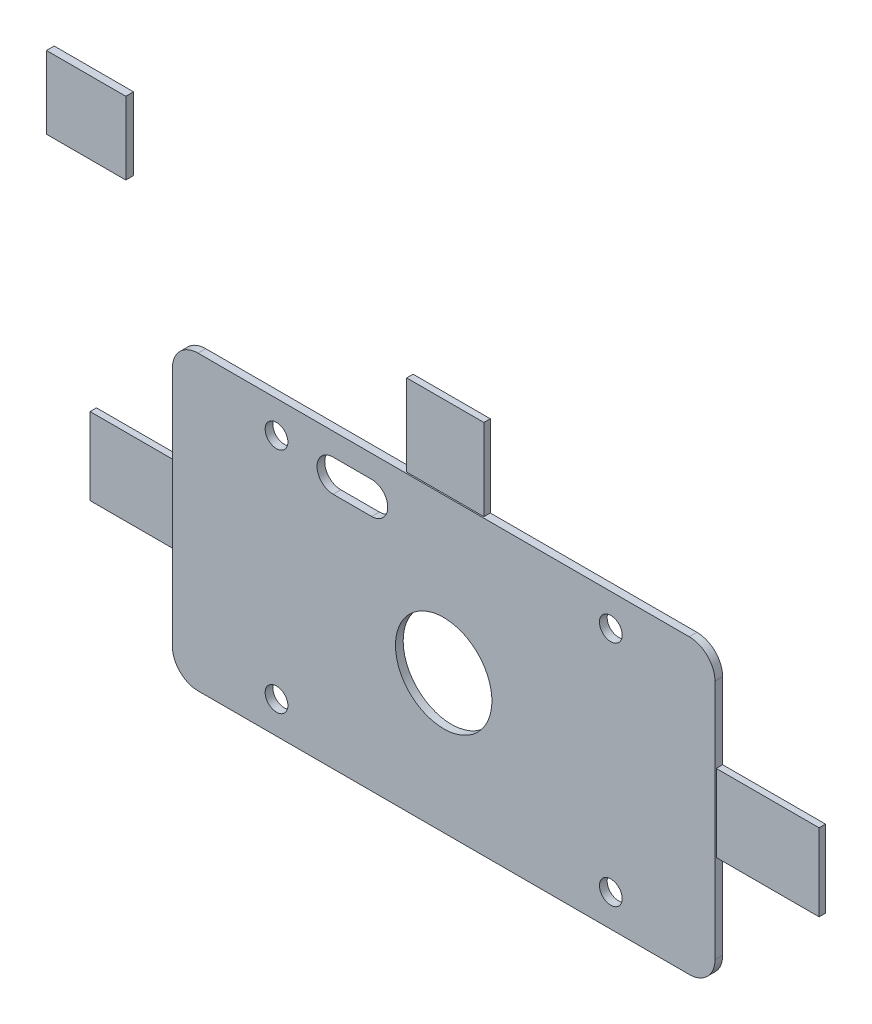
from build123d import *

# Parameters (mm, degrees)
SKETCH1_W                   = 107.188
SKETCH1_H                   = 57.785
BASE_FLANGE1_DEPTH          = 1.524
F_16_0_177_DIAMETER_HOLE1_D = 4.4958
SKETCH9_R                   = 9.525
CUT_EXTRUDE1_DEPTH          = 61.904974906
FILLET1_R                   = 5.08
SKETCH21_W                  = 15.670888323
SKETCH21_H                  = 14.335334597
BOSS_EXTRUDE2_DEPTH         = 1.524
SKETCH26_W                  = 16.520642104
SKETCH26_H                  = 15.24
SKETCH26_W_2                = 20.320035359
SKETCH26_W_3                = 15.24
SKETCH26_H_2                = 16.119874992
BOSS_EXTRUDE3_DEPTH         = 1.27


# Sheet-metal steps are written as plain solids
with BuildPart() as part:
    # Sketch1 → Base-Flange1 (new body)
    with BuildSketch(Plane.XY):
        Rectangle(SKETCH1_W, SKETCH1_H)
    extrude(amount=-BASE_FLANGE1_DEPTH)

    # #16 (0.177) Diameter Hole1 (through all)
    with Locations(Plane.XY):
        with Locations((-33.02, 22.5425), (33.02, 22.5425), (33.02, -22.5425), (-33.02, -22.5425)):
            Hole(F_16_0_177_DIAMETER_HOLE1_D / 2)

    # Sketch9 → Cut-Extrude1 (cut, through all)
    with BuildSketch(Plane(origin=(0, 0, -1.524), x_dir=(-1, 0, 0), z_dir=(0, 0, -1))):
        with Locations((0, -1.5875)):
            Circle(SKETCH9_R)
        with BuildLine():
            Line((14.224, 24.4475), (21.844, 24.4475))
            ThreePointArc((21.844, 24.4475), (25.019, 21.2725), (21.844, 18.0975))
            Line((21.844, 18.0975), (14.224, 18.0975))
            ThreePointArc((14.224, 18.0975), (11.049, 21.2725), (14.224, 24.4475))
        make_face()
    extrude(amount=-CUT_EXTRUDE1_DEPTH, mode=Mode.SUBTRACT)

    # Fillet1
    fillet1_edges = [part.edges().sort_by_distance(p)[0] for p in [
        (-53.594, 28.8925, -0.762),
        (53.594, 28.8925, -0.762),
        (53.594, -28.8925, -0.762),
        (-53.594, -28.8925, -0.762),
    ]]
    fillet(fillet1_edges, radius=FILLET1_R)

    # Sketch26 → Boss-Extrude3 (add)
    with BuildSketch(Plane(origin=(0, 0, -1.524), x_dir=(-1, 0, 0), z_dir=(0, 0, -1))):
        with Locations((61.854321052, 0.35968498)):
            Rectangle(SKETCH26_W, SKETCH26_H)
        with Locations((-63.75401768, 1.15731215)):
            Rectangle(SKETCH26_W_2, SKETCH26_H)
        with Locations((-0.062117332, 36.952437496)):
            Rectangle(SKETCH26_W_3, SKETCH26_H_2)
    extrude(amount=-BOSS_EXTRUDE3_DEPTH)


with BuildPart() as body_2:
    # Sketch21 → Boss-Extrude2 (new body)
    with BuildSketch(Plane(origin=(0, 0, -1.524), x_dir=(-1, 0, 0), z_dir=(0, 0, -1))):
        with Locations((70.633718088, 58.536455808)):
            Rectangle(SKETCH21_W, SKETCH21_H)
    extrude(amount=-BOSS_EXTRUDE2_DEPTH)


solid = Compound([part.part, body_2.part])
